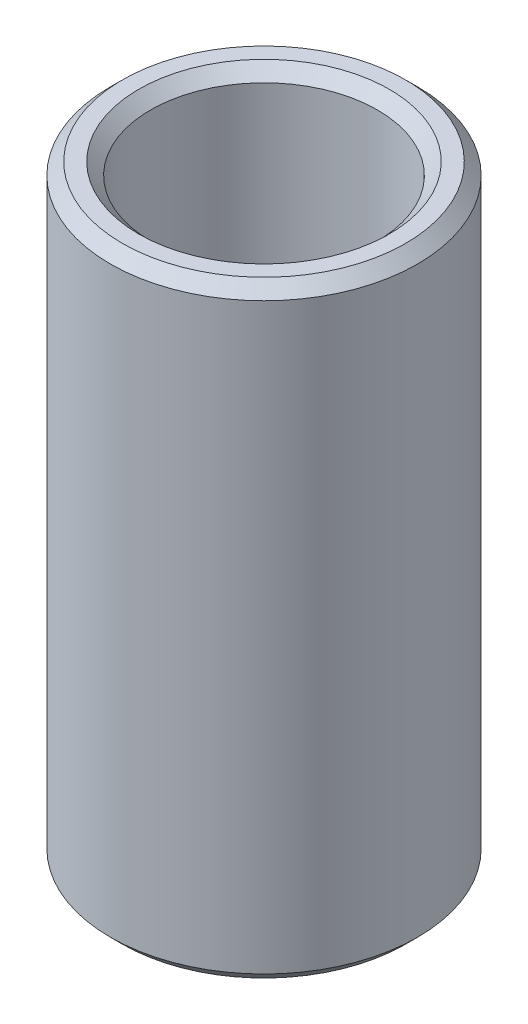
from build123d import *

# Parameters (mm, degrees)
SKETCH1_R           = 42.5
BOSS_EXTRUDE1_DEPTH = 167.971312469
SKETCH2_R           = 31.395383457
CUT_EXTRUDE1_DEPTH  = 179.400845886
CHAMFER1_SIZE       = 3.299275839


with BuildPart() as part:
    # Sketch1 → Boss-Extrude1 (new body)
    with BuildSketch(Plane(origin=(0, 0, 0), x_dir=(1, 0, 0), z_dir=(0, 1, 0))):
        Circle(SKETCH1_R)
    extrude(amount=BOSS_EXTRUDE1_DEPTH)

    # Sketch2 → Cut-Extrude1 (cut, through all)
    with BuildSketch(Plane(origin=(0, 0, 0), x_dir=(1, 0, 0), z_dir=(0, 1, 0))):
        Circle(SKETCH2_R)
    extrude(amount=CUT_EXTRUDE1_DEPTH, mode=Mode.SUBTRACT)

    # Chamfer1
    chamfer1_edges = [part.edges().sort_by_distance(p)[0] for p in [
        (-31.395383457, 167.971312469, 0),
        (-31.395383457, 0, 0),
        (-42.5, 0, 0),
        (-42.5, 167.971312469, 0),
    ]]
    chamfer(chamfer1_edges, length=CHAMFER1_SIZE)


solid = part.part
